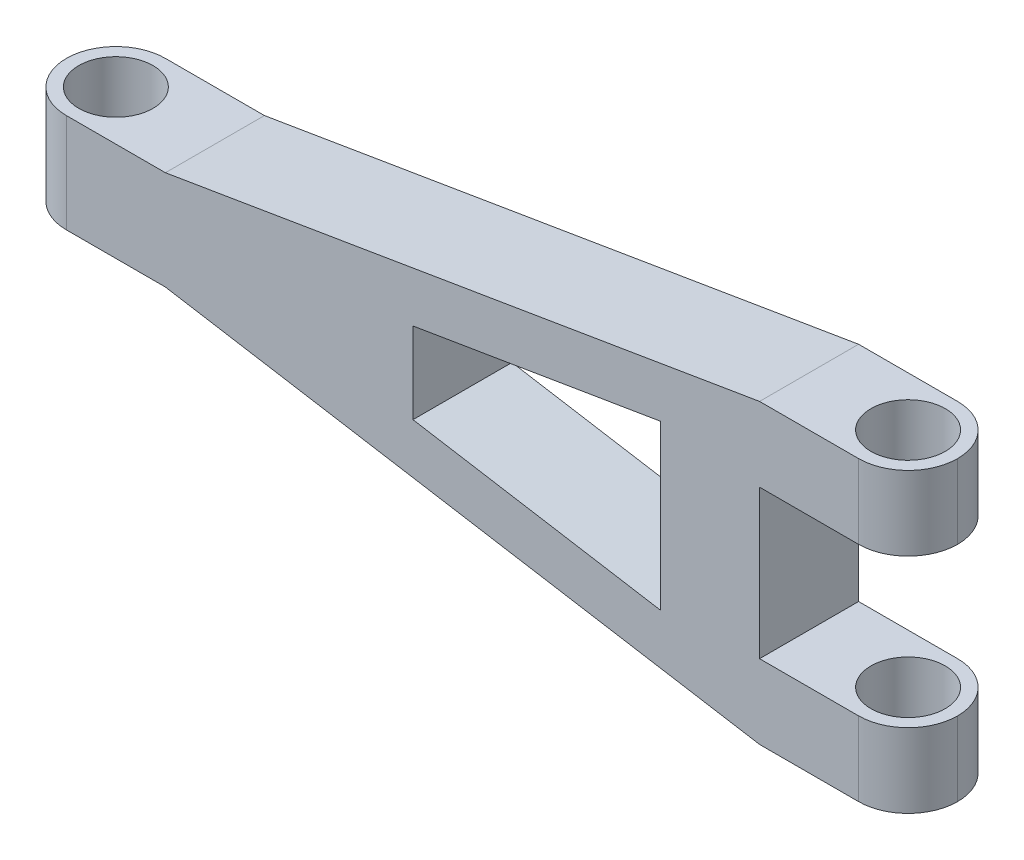
from build123d import *

# Parameters (mm, degrees)
BASE_EXTRUDE_DEPTH      = 20
FILLET1_R               = 10
CUT_EXTRUDE1_DEPTH      = 108.819293264
CUT_EXTRUDE1_DEPTH_BACK = 108.819293264
SKETCH2_R               = 7.5


with BuildPart() as part:
    # Sketch1 → Base-Extrude (new body)
    with BuildSketch(Plane.XY):
        Polygon((-80, 15), (-50, 15), (70, 35), (100, 35), (100, 20), (70, 20), (70, -10), (100, -10), (100, -25), (70, -25), (-50, -5), (-80, -5), align=None)
        Polygon((50, 21.528729116), (0, 13.195395783), (0, -3.195395783), (50, -11.528729116), align=None, mode=Mode.SUBTRACT)
    extrude(amount=BASE_EXTRUDE_DEPTH)

    # Fillet1
    # the kernel refuses this fillet: 10 mm, written as the material it takes off along each edge
    with BuildSketch(Plane(origin=(100, 60, 0), x_dir=(0, 0, 1), z_dir=(0, -1, 0)), Plane(origin=(100, 15, 0), x_dir=(0, 0, 1), z_dir=(0, -1, 0))) as fillet1_piece_1:
        with BuildLine():
            CenterArc((FILLET1_R, FILLET1_R), FILLET1_R, 180, 90)
            Line((0, FILLET1_R), (0, 0))
            Line((0, 0), (FILLET1_R, 0))
        make_face()
    extrude(amount=65, mode=Mode.SUBTRACT)
    with BuildSketch(Plane(origin=(-80, -30, 0), x_dir=(0, 0, 1), z_dir=(0, 1, 0))) as fillet1_piece_2:
        with BuildLine():
            CenterArc((FILLET1_R, FILLET1_R), FILLET1_R, 180, 90)
            Line((0, FILLET1_R), (0, 0))
            Line((0, 0), (FILLET1_R, 0))
        make_face()
    extrude(amount=70, mode=Mode.SUBTRACT)
    with BuildSketch(Plane(origin=(100, 15, 20), x_dir=(0, 0, -1), z_dir=(0, -1, 0)), Plane(origin=(100, 60, 20), x_dir=(0, 0, -1), z_dir=(0, -1, 0))) as fillet1_piece_3:
        with BuildLine():
            CenterArc((FILLET1_R, -FILLET1_R), FILLET1_R, 90, 90)
            Line((0, -FILLET1_R), (0, 0))
            Line((0, 0), (FILLET1_R, 0))
        make_face()
    extrude(amount=65, mode=Mode.SUBTRACT)
    with BuildSketch(Plane(origin=(-80, -30, 20), x_dir=(0, 0, -1), z_dir=(0, 1, 0))) as fillet1_piece_4:
        with BuildLine():
            CenterArc((FILLET1_R, -FILLET1_R), FILLET1_R, 90, 90)
            Line((0, -FILLET1_R), (0, 0))
            Line((0, 0), (FILLET1_R, 0))
        make_face()
    extrude(amount=70, mode=Mode.SUBTRACT)

    # Sketch2 → Cut-Extrude1 (cut, two sides: drawn at the far end of the back side and taken through both)
    with BuildSketch(Plane(origin=(0, 0, 0), x_dir=(1, 0, 0), z_dir=(0, 1, 0)).offset(-CUT_EXTRUDE1_DEPTH_BACK)):
        with Locations(Location((90, -10, 0), (0, 0, 270))):
            Circle(SKETCH2_R)
        with Locations(Location((-70, -10, 0), (0, 0, 270))):
            Circle(SKETCH2_R)
    extrude(amount=CUT_EXTRUDE1_DEPTH + CUT_EXTRUDE1_DEPTH_BACK, mode=Mode.SUBTRACT)


solid = part.part
